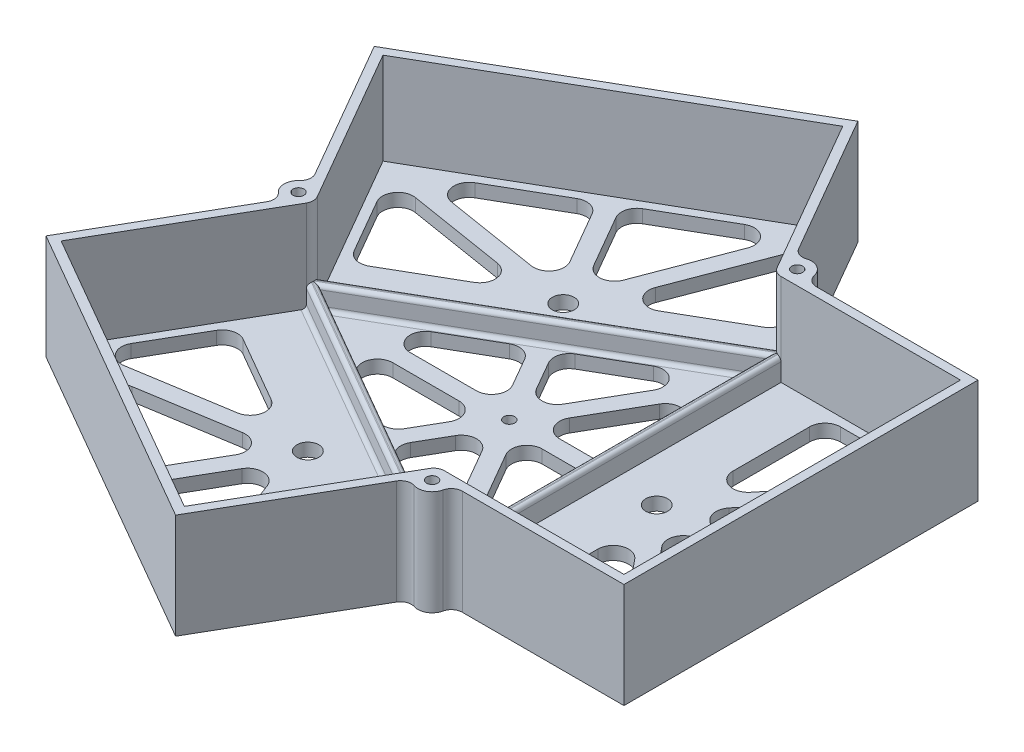
from build123d import *
from build123d.topology import SkipClean

# Parameters (mm, degrees)
SKETCH1_R           = 2.5000000000004525
SKETCH1_R_2         = 1.2499999999775333
SKETCH1_R_3         = 2.4999999999966116
SKETCH1_R_4         = 2.500000003454781
BOSS_EXTRUDE1_DEPTH = 3
BOSS_EXTRUDE2_DEPTH = 21
CUT_EXTRUDE1_DEPTH  = 135.64659558713754
FILLET1_R           = 2.5
BOSS_EXTRUDE3_START = 5
BOSS_EXTRUDE3_DEPTH = 5
FILLET2_R           = 0.9
FILLET3_R           = 3.5


with BuildPart() as part:
    # Sketch1 → Boss-Extrude1 (new body)
    with BuildSketch(Plane(origin=(0, 0, 0), x_dir=(1, 0, 0), z_dir=(0, 1, 0))):
        Polygon((56.65645136926783, -60.10357187391411), (89.54322408274156, -60.103571873914106), (89.54322408274156, 20.896428126098755), (56.65645136929464, 20.89642812609875), (40.952566782375555, 29.9630701196793), (24.509180425640395, 58.44385073802949), (-45.638877280922244, 17.943850738016113), (-29.195490924188032, -10.536929880332416), (-29.195490924188025, -28.6702138674958), (-45.63887728092128, -57.15099448584285), (24.50918042561817, -97.65099448584279), (40.95256678235395, -69.17021386749165), align=None)
        Polygon((2.098354485724329, -51.4676836533243), (-10.296899235219248, -72.93689287070575), (-36.64547418382551, -57.72453603136489), align=None, mode=Mode.SUBTRACT)
        Polygon((5.562456100861928, -53.46768365332455), (19.515777328519537, -90.14924971004358), (-6.832797620081495, -74.93689287070575), align=None, mode=Mode.SUBTRACT)
        Polygon((-26.67477566578673, -32.30420696853079), (0.06744719362658763, -47.74383653514203), (-39.25521457191352, -54.094166335458645), align=None, mode=Mode.SUBTRACT)
        with Locations(Location((5.9351515723503665, -48.82215616096494, 0), (0, 0, 270))):
            Circle(SKETCH1_R, mode=Mode.SUBTRACT)
        Polygon((19.34040746067872, -21.603571873920448), (10.778229596270998, -36.43369895851621), (-14.908303996952178, -21.603571873920448), align=None, mode=Mode.SUBTRACT)
        with Locations(Location((22.804509000002103, -19.60357200000875, 0), (0, 0, 270))):
            Circle(SKETCH1_R_2, mode=Mode.SUBTRACT)
        Polygon((9.802855951071862, -53.3645774019241), (36.54507881047721, -68.80420696853074), (23.964639904353078, -90.59416633545398), align=None, mode=Mode.SUBTRACT)
        Polygon((22.804509075842958, -23.603571873934307), (39.92886480465965, -53.26382604312798), (14.242331211434607, -38.433698958531146), align=None, mode=Mode.SUBTRACT)
        Polygon((26.26861069097249, -21.603571873920448), (43.392966196854054, -21.603571873920448), (43.39296619685239, -51.2638256569801), align=None, mode=Mode.SUBTRACT)
        Polygon((58.54322408275646, -56.10357187391411), (58.543224082756446, -25.22431274517261), (83.70410189401808, -56.10357187391412), align=None, mode=Mode.SUBTRACT)
        Polygon((85.54322408274153, -21.603571873907672), (85.54322408274153, -52.028285553285954), (60.752716637667696, -21.603571873907672), align=None, mode=Mode.SUBTRACT)
        Polygon((0.0674471936710681, 8.536692787309843), (-26.674775665774362, -6.902936779318866), (-39.25521457191333, 14.887022587629906), align=None, mode=Mode.SUBTRACT)
        Polygon((19.34040746069591, -17.603571873918206), (-14.908303560165617, -17.603571873918202), (10.778229705480529, -2.7734449784491244), align=None, mode=Mode.SUBTRACT)
        with Locations(Location((5.935151572357302, 9.615012413111248, 0), (0, 0, 270))):
            Circle(SKETCH1_R_3, mode=Mode.SUBTRACT)
        Polygon((2.098354485734852, 12.26053990550171), (-36.64547418382336, 18.517392283539962), (-10.296899235209807, 33.729749122885025), align=None, mode=Mode.SUBTRACT)
        Polygon((19.51577732854151, 50.9421059622301), (5.5624561008726, 14.26053990550171), (-6.832797620072052, 35.729749122885025), align=None, mode=Mode.SUBTRACT)
        Polygon((26.268610690958532, -17.603571873918206), (43.39296619685594, 12.056681909161409), (43.392966196854275, -17.603571873918206), align=None, mode=Mode.SUBTRACT)
        Polygon((22.804509075825827, -15.603571873904249), (14.24233132061928, -0.7734449784485484), (39.92886458624059, 14.056681917006195), align=None, mode=Mode.SUBTRACT)
        with Locations(Location((56.543224078743656, -19.603571872662247, 0), (0, 0, 270))):
            Circle(SKETCH1_R_4, mode=Mode.SUBTRACT)
        Polygon((60.7527166376677, -17.60357187390767), (85.54322408274153, 12.821141805470615), (85.54322408274153, -17.60357187390767), align=None, mode=Mode.SUBTRACT)
        Polygon((58.543224082756446, -13.982831003337512), (58.54322408275811, 16.89642812609875), (83.70410189455097, 16.896428126098755), align=None, mode=Mode.SUBTRACT)
        Polygon((36.5450788105132, 29.597063220693602), (9.802855951060122, 14.157433654059325), (23.964639904370056, 51.38702258764974), align=None, mode=Mode.SUBTRACT)
    extrude(amount=BOSS_EXTRUDE1_DEPTH)

    # Sketch2 → Boss-Extrude2 (add)
    with BuildSketch(Plane(origin=(0, 3, 0), x_dir=(1, 0, 0), z_dir=(0, 1, 0))):
        with BuildLine():
            Line((-24.173476287988574, -19.60357187391417), (-21.65146165178912, -19.6035718739142))
            Line((-21.65146165178912, -19.6035718739142), (-42.906826473353355, 17.21179993044725))
            Line((-42.906826473353355, 17.211799930447246), (23.777129618071534, 55.711799930460586))
            Line((23.777129618071534, 55.71179993046059), (45.032494439636004, 18.896428126098748))
            Line((45.032494439636004, 18.896428126098744), (46.293501757735555, 21.08055686976334))
            ThreePointArc((46.29350175773554, 21.08055686976335), (45.835970003005016, 22.788088624493902), (47.54350175773557, 23.245620379224423))
            Line((47.543501757735555, 23.245620379224427), (48.804509075835114, 25.429749122889028))
            Line((48.804509075835114, 25.42974912288902), (40.95256678237556, 29.9630701196793))
            Line((40.95256678237556, 29.9630701196793), (24.5091804256404, 58.44385073802949))
            Line((24.509180425640402, 58.4438507380295), (-45.63887728092225, 17.943850738016117))
            Line((-45.63887728092225, 17.943850738016117), (-29.195490924188032, -10.536929880332416))
            Line((-29.195490924188032, -10.536929880332416), (-29.19549092418803, -19.60357187391411))
            Line((-29.19549092418803, -19.60357187391411), (-26.673476287988574, -19.603571873914138))
            ThreePointArc((-26.673476287988574, -19.603571873914152), (-25.423476287988574, -18.353571873914152), (-24.173476287988574, -19.603571873914152))
        make_face()
        with BuildLine():
            Line((-42.90682647335239, -56.41894367827395), (-21.651461651789116, -19.6035718739142))
            Line((-21.65146165178912, -19.6035718739142), (-24.173476287988574, -19.60357187391417))
            ThreePointArc((-24.173476287988574, -19.603571873914152), (-25.423476287988574, -20.853571873914152), (-26.673476287988574, -19.603571873914152))
            Line((-26.673476287988574, -19.603571873914138), (-29.19549092418803, -19.60357187391411))
            Line((-29.19549092418803, -19.60357187391411), (-29.195490924188025, -28.670213867495804))
            Line((-29.195490924188025, -28.670213867495804), (-45.63887728092128, -57.15099448584286))
            Line((-45.63887728092128, -57.15099448584286), (24.509180425618187, -97.65099448584279))
            Line((24.509180425618187, -97.65099448584279), (40.95256678235394, -69.17021386749165))
            Line((40.95256678235394, -69.17021386749165), (48.804509075810884, -64.63689287070288))
            Line((48.804509075810884, -64.63689287070288), (47.543501757711766, -62.45276412703905))
            ThreePointArc((47.54350175771178, -62.452764127039046), (45.83597000298122, -61.99523237230852), (46.293501757711745, -60.28770061757796))
            Line((46.29350175771176, -60.287700617577954), (45.03249443961264, -58.10357187391411))
            Line((45.03249443961264, -58.10357187391411), (23.777129618049344, -94.91894367827395))
            Line((23.777129618049344, -94.91894367827395), (-42.906826473352396, -56.41894367827395))
        make_face()
        with BuildLine():
            Line((46.293501757735555, 21.08055686976334), (45.032494439636004, 18.896428126098744))
            Line((45.032494439636004, 18.896428126098744), (87.54322408274155, 18.896428126098748))
            Line((87.54322408274155, 18.896428126098748), (87.54322408274155, -58.1035718739141))
            Line((87.54322408274155, -58.103571873914106), (45.03249443961264, -58.10357187391411))
            Line((45.03249443961264, -58.10357187391411), (46.29350175771176, -60.287700617577954))
            ThreePointArc((46.293501757711745, -60.28770061757796), (47.54350175771176, -60.28770061757794), (48.16850175771177, -61.3702323723085))
            ThreePointArc((48.16850175771177, -61.3702323723085), (48.00103351244232, -61.99523237230849), (47.54350175771178, -62.452764127039046))
            Line((47.543501757711766, -62.45276412703905), (48.804509075810884, -64.63689287070288))
            Line((48.804509075810884, -64.63689287070288), (56.65645136926783, -60.10357187391411))
            Line((56.65645136926783, -60.10357187391411), (89.54322408274156, -60.103571873914106))
            Line((89.54322408274156, -60.103571873914106), (89.54322408274156, 20.896428126098755))
            Line((89.54322408274156, 20.896428126098755), (56.65645136929464, 20.89642812609875))
            Line((56.65645136929464, 20.89642812609875), (48.804509075835114, 25.42974912288902))
            Line((48.804509075835114, 25.429749122889028), (47.543501757735555, 23.245620379224427))
            ThreePointArc((47.54350175773557, 23.245620379224423), (48.00103351246611, 22.788088624493877), (48.168501757735555, 22.163088624493888))
            ThreePointArc((48.168501757735555, 22.163088624493888), (47.54350175773555, 21.08055686976334), (46.29350175773554, 21.08055686976335))
        make_face()
    extrude(amount=BOSS_EXTRUDE2_DEPTH)

    # Sketch4 → Cut-Extrude1 (cut, through all)
    with SkipClean():  # the faces are left unmerged after this step: merging them gives an invalid solid
        with BuildSketch(Plane(origin=(0, 24, 0), x_dir=(1, 0, 0), z_dir=(0, 1, 0))):
            with BuildLine():
                Line((-29.195490924188032, -10.536929880332416), (-25.832059375307356, -16.36256421077386))
                ThreePointArc((-25.832059375307356, -16.36256421077386), (-28.690136786384, -19.603571873914127), (-25.832059375307402, -22.84457953705444))
                Line((-25.832059375307402, -22.84457953705444), (-29.195490924188025, -28.670213867495804))
                Line((-29.195490924188025, -28.670213867495804), (-29.195490924188032, -10.536929880332416))
            make_face()
            with BuildLine():
                Line((40.95256677782538, 29.963069864886865), (56.65645136474641, 20.8964278713051))
                Line((56.65645136474641, 20.8964278713051), (49.929588266985036, 20.89642787130515))
                ThreePointArc((49.929588266985036, 20.89642787130515), (48.55183200238386, 24.99209934685012), (44.31599832670601, 24.1374355344455))
                Line((44.31599832670601, 24.1374355344455), (40.95256677782538, 29.963069864886865))
            make_face()
            with BuildLine():
                Line((56.65645114636252, -60.10357199738482), (40.95256655944137, -69.17021399096637))
                Line((40.95256655944137, -69.17021399096637), (44.31599810832213, -63.34457966052498))
                ThreePointArc((44.31599810832213, -63.34457966052498), (48.551831783999944, -64.19924347292971), (49.92958804860124, -60.10357199738478))
                Line((49.92958804860124, -60.10357199738478), (56.65645114636252, -60.10357199738482))
            make_face()
        extrude(amount=-CUT_EXTRUDE1_DEPTH, mode=Mode.SUBTRACT)

    # Fillet1
    fillet1_edges = [part.edges().sort_by_distance(p)[0] for p in [
        (45.03249443961264, 13.5, 58.10357187391411),
        (-21.65146165178912, 13.5, 19.6035718739142),
        (45.032494439636004, 13.5, -18.896428126098748),
        (-25.832059375307356, 12, 16.36256421077386),
        (-25.832059375307402, 12, 22.84457953705444),
        (49.929588266985036, 12, -20.89642787130515),
        (44.31599832670601, 12, -24.1374355344455),
        (44.31599810832213, 12, 63.34457966052498),
        (49.92958804860124, 12, 60.10357199738478),
    ]]
    fillet(fillet1_edges, radius=FILLET1_R)

    # Sketch5 → Boss-Extrude3 (add)
    with SkipClean():  # the faces are left unmerged after this step: merging them gives an invalid solid
        with BuildSketch(Plane(origin=(0, 3, 0), x_dir=(1, 0, 0), z_dir=(0, 1, 0)).offset(BOSS_EXTRUDE3_START)):
            with BuildLine():
                Line((-22.37314948827615, -20.853571873914206), (44.310806603125606, -59.35357187391412))
                ThreePointArc((44.310806603125606, -59.35357187391412), (45.225870112586705, -58.43850836445302), (46.475870112586705, -58.10357187391411))
                Line((46.475870112586705, -58.10357187391411), (46.47587011261007, 18.896428126098744))
                ThreePointArc((46.47587011261007, 18.896428126098744), (45.22587011261007, 19.231364616637638), (44.31080660314897, 20.146428126098733))
                Line((44.31080660314897, 20.146428126098733), (-22.373149488276148, -18.35357187391421))
                ThreePointArc((-22.373149488276148, -18.35357187391421), (-22.038212997737247, -19.60357187391421), (-22.37314948827615, -20.853571873914206))
            make_face()
            Polygon((44.47587011261007, 17.932326510960987), (-20.538212997737247, -19.60357187391421), (44.47587011261007, -57.139470258789856), align=None, mode=Mode.SUBTRACT)
        extrude(amount=-BOSS_EXTRUDE3_DEPTH)

    # Fillet2
    # the kernel refuses this fillet: 0.9 mm, written as the material it adds along each edge
    with BuildSketch(Plane(origin=(44.47587011261007, 3, 59.389470258789856), x_dir=(-1, 0, 0), z_dir=(0, 0, -1))) as fillet2_piece_1_section:
        with BuildLine():
            CenterArc((FILLET2_R, FILLET2_R), FILLET2_R, 179.99999999999997, 90)
            Line((0, FILLET2_R), (0, 0))
            Line((0, 0), (FILLET2_R, 0))
        make_face()
    fillet2_piece_1 = extrude(amount=79.57179676975085, mode=Mode.PRIVATE)
    fillet2_piece_1 = split(fillet2_piece_1, bisect_by=Plane(origin=(10.994549978179414, 3, 1.3981226814763232), z_dir=(0.4999999999999948, 0, 0.8660254037844417)), keep=Keep.TOP, mode=Mode.PRIVATE)
    add(fillet2_piece_1)
    with BuildSketch(Plane(origin=(46.42442727112506, 3, -19.057326510960976), x_dir=(0.49999999999999484, 0, 0.8660254037844417), z_dir=(-0.8660254037844417, 0, 0.4999999999999948))) as fillet2_piece_2_section:
        with BuildLine():
            CenterArc((FILLET2_R, FILLET2_R), FILLET2_R, 179.99999999999997, 90)
            Line((-4.8e-16, FILLET2_R), (0, 0))
            Line((0, 0), (FILLET2_R, 0))
        make_face()
    fillet2_piece_2 = extrude(amount=79.5717967697512, mode=Mode.PRIVATE)
    fillet2_piece_2 = split(fillet2_piece_2, bisect_by=Plane(origin=(44.47587011261007, 3, -19.057326510960976), z_dir=(-1, 0, 0)), keep=Keep.TOP, mode=Mode.PRIVATE)
    add(fillet2_piece_2)
    with BuildSketch(Plane(origin=(-22.37314948827615, 3, 20.853571873914206), x_dir=(-0.49999999999999933, 0, 0.866025403784439), z_dir=(0.866025403784439, 0, 0.4999999999999993))) as fillet2_piece_3:
        with BuildLine():
            CenterArc((FILLET2_R, -FILLET2_R), FILLET2_R, 90, 90)
            Line((1.78e-15, -FILLET2_R), (0, 0))
            Line((0, 0), (FILLET2_R, 0))
        make_face()
    extrude(amount=76.99999999999994)
    # the kernel refuses this fillet: 0.9 mm, written as the material it takes off along each edge
    with BuildSketch(Plane(origin=(-24.321706646791146, 8, 19.728571873914206), x_dir=(0.49999999999999933, 0, -0.866025403784439), z_dir=(0.866025403784439, 0, 0.4999999999999993))) as fillet2_2_piece_1_section:
        with BuildLine():
            CenterArc((FILLET2_R, -FILLET2_R), FILLET2_R, 90, 90)
            Line((1.78e-15, -FILLET2_R), (0, 0))
            Line((0, 0), (FILLET2_R, 0))
        make_face()
    fillet2_2_piece_1 = extrude(amount=81.49999999999993, mode=Mode.PRIVATE)
    fillet2_2_piece_1 = fillet2_2_piece_1 - Plane(origin=(-24.53821299773724, 8, 19.6035718739142), x_dir=(0.8660254037844387, 0, -0.4999999999999999), z_dir=(0, 1, 0)) * Cylinder(2.5, 167, mode=Mode.PRIVATE)
    fillet2_2_piece_1 = fillet2_2_piece_1 - Plane(origin=(46.475870112586705, 8, 60.60357187391411), x_dir=(-0.8660254037844388, 0, -0.49999999999999983), z_dir=(0, 1, 0)) * Cylinder(2.5, 167, mode=Mode.PRIVATE)
    add(fillet2_2_piece_1, mode=Mode.SUBTRACT)
    with BuildSketch(Plane(origin=(46.47587011258602, 8, 60.35357187391411), x_dir=(-1, 0, -3.0341e-13), z_dir=(3.0341e-13, 0, -1))) as fillet2_2_piece_2_section:
        with BuildLine():
            CenterArc((FILLET2_R, -FILLET2_R), FILLET2_R, 90, 90)
            Line((0, -FILLET2_R), (0, 0))
            Line((0, 0), (FILLET2_R, 0))
        make_face()
    fillet2_2_piece_2 = extrude(amount=81.50000000001286, mode=Mode.PRIVATE)
    fillet2_2_piece_2 = fillet2_2_piece_2 - Plane(origin=(46.475870112586705, 8, 60.60357187391411), x_dir=(-0.8660254037844388, 0, -0.49999999999999983), z_dir=(0, 1, 0)) * Cylinder(2.5, 167, mode=Mode.PRIVATE)
    fillet2_2_piece_2 = fillet2_2_piece_2 - Plane(origin=(46.475870112610075, 8, -21.39642812609874), x_dir=(-0.8660254037844387, 0, 0.5000000000000001), z_dir=(0, 1, 0)) * Cylinder(2.5, 167, mode=Mode.PRIVATE)
    add(fillet2_2_piece_2, mode=Mode.SUBTRACT)
    with BuildSketch(Plane(origin=(46.25936376166396, 8, -21.271428126098723), x_dir=(0.49999999999999484, 0, 0.8660254037844416), z_dir=(-0.8660254037844416, 0, 0.49999999999999484))) as fillet2_2_piece_3_section:
        with BuildLine():
            CenterArc((FILLET2_R, -FILLET2_R), FILLET2_R, 90, 90)
            Line((0, -FILLET2_R), (0, 0))
            Line((0, 0), (FILLET2_R, 0))
        make_face()
    fillet2_2_piece_3 = extrude(amount=81.50000000002669, mode=Mode.PRIVATE)
    fillet2_2_piece_3 = fillet2_2_piece_3 - Plane(origin=(-24.53821299773724, 8, 19.6035718739142), x_dir=(0.8660254037844387, 0, -0.4999999999999999), z_dir=(0, 1, 0)) * Cylinder(2.5, 167, mode=Mode.PRIVATE)
    fillet2_2_piece_3 = fillet2_2_piece_3 - Plane(origin=(46.475870112610075, 8, -21.39642812609874), x_dir=(-0.8660254037844387, 0, 0.5000000000000001), z_dir=(0, 1, 0)) * Cylinder(2.5, 167, mode=Mode.PRIVATE)
    add(fillet2_2_piece_3, mode=Mode.SUBTRACT)
    with BuildSketch(Plane(origin=(44.47587011261007, 8, 59.389470258789856), x_dir=(1, 0, 0), z_dir=(0, 0, -1))) as fillet2_2_piece_4_section:
        with BuildLine():
            CenterArc((FILLET2_R, FILLET2_R), FILLET2_R, 180, 90)
            Line((0, FILLET2_R), (0, 0))
            Line((0, 0), (FILLET2_R, 0))
        make_face()
    fillet2_2_piece_4 = extrude(amount=79.57179676975085, mode=Mode.PRIVATE)
    fillet2_2_piece_4 = split(fillet2_2_piece_4, bisect_by=Plane(origin=(10.994549978179407, 8, 1.398122681476309), z_dir=(0.4999999999999948, 0, 0.8660254037844417)), keep=Keep.TOP, mode=Mode.PRIVATE)
    fillet2_2_piece_4 = split(fillet2_2_piece_4, bisect_by=Plane(origin=(45.450148691867554, 8, 57.701970258789856), z_dir=(0.4999999999999993, 0, -0.8660254037844392)), keep=Keep.TOP, mode=Mode.PRIVATE)
    add(fillet2_2_piece_4, mode=Mode.SUBTRACT)
    with BuildSketch(Plane(origin=(46.42442727112506, 8, -19.057326510960976), x_dir=(-0.49999999999999484, 0, -0.8660254037844417), z_dir=(-0.8660254037844417, 0, 0.4999999999999948))) as fillet2_2_piece_5_section:
        with BuildLine():
            CenterArc((FILLET2_R, FILLET2_R), FILLET2_R, 180, 90)
            Line((4.8e-16, FILLET2_R), (0, 0))
            Line((0, 0), (FILLET2_R, 0))
        make_face()
    fillet2_2_piece_5 = extrude(amount=79.5717967697512, mode=Mode.PRIVATE)
    fillet2_2_piece_5 = split(fillet2_2_piece_5, bisect_by=Plane(origin=(12.943107136694202, 8, 38.93402106635222), z_dir=(0.4999999999999993, 0, -0.8660254037844392)), keep=Keep.TOP, mode=Mode.PRIVATE)
    fillet2_2_piece_5 = split(fillet2_2_piece_5, bisect_by=Plane(origin=(44.47587011261007, 8, -19.057326510960976), z_dir=(-1, 0, 0)), keep=Keep.TOP, mode=Mode.PRIVATE)
    add(fillet2_2_piece_5, mode=Mode.SUBTRACT)
    with BuildSketch(Plane(origin=(-22.48677015625224, 8, 18.47857187391421), x_dir=(-0.49999999999999933, 0, 0.8660254037844392), z_dir=(0.8660254037844392, 0, 0.4999999999999993))) as fillet2_2_piece_6_section:
        with BuildLine():
            CenterArc((FILLET2_R, FILLET2_R), FILLET2_R, 180, 90)
            Line((4.38e-15, FILLET2_R), (0, 0))
            Line((0, 0), (FILLET2_R, 0))
        make_face()
    fillet2_2_piece_6 = extrude(amount=79.57179676975142, mode=Mode.PRIVATE)
    fillet2_2_piece_6 = split(fillet2_2_piece_6, bisect_by=Plane(origin=(-21.51249157699476, 8, 20.166071873914216), z_dir=(0.4999999999999948, 0, 0.8660254037844417)), keep=Keep.TOP, mode=Mode.PRIVATE)
    fillet2_2_piece_6 = split(fillet2_2_piece_6, bisect_by=Plane(origin=(44.475870112610075, 8, 18.47857187391421), z_dir=(-1, 0, 0)), keep=Keep.TOP, mode=Mode.PRIVATE)
    add(fillet2_2_piece_6, mode=Mode.SUBTRACT)
    with BuildSketch(Plane(origin=(44.47587011261007, 8, 59.389470258789856), x_dir=(1, 0, 0), z_dir=(0, 0, -1))) as fillet2_2_piece_7a_section:
        with BuildLine():
            CenterArc((FILLET2_R, FILLET2_R), FILLET2_R, 180, 90)
            Line((0, FILLET2_R), (0, 0))
            Line((0, 0), (FILLET2_R, 0))
        make_face()
    fillet2_2_piece_7a = extrude(amount=79.57179676975085, mode=Mode.PRIVATE)
    fillet2_2_piece_7a = split(fillet2_2_piece_7a, bisect_by=Plane(origin=(45.45014869186756, 8, 57.70197025878985), z_dir=(-0.4999999999999993, 0, 0.8660254037844392)), keep=Keep.TOP, mode=Mode.PRIVATE)
    fillet2_2_piece_7a = fillet2_2_piece_7a - Plane(origin=(46.475870112586705, 8, 60.60357187391411), x_dir=(-0.8660254037844388, 0, -0.49999999999999983), z_dir=(0, 1, 0)) * Cylinder(2.5, 163, mode=Mode.PRIVATE)
    with BuildSketch(Plane(origin=(-22.48677015625224, 8, 18.47857187391421), x_dir=(-0.49999999999999933, 0, 0.8660254037844392), z_dir=(0.8660254037844392, 0, 0.4999999999999993))) as fillet2_2_piece_7b_section:
        with BuildLine():
            CenterArc((FILLET2_R, FILLET2_R), FILLET2_R, 180, 90)
            Line((4.38e-15, FILLET2_R), (0, 0))
            Line((0, 0), (FILLET2_R, 0))
        make_face()
    fillet2_2_piece_7b = extrude(amount=79.57179676975142, mode=Mode.PRIVATE)
    fillet2_2_piece_7b = split(fillet2_2_piece_7b, bisect_by=Plane(origin=(44.475870112610075, 8, 18.47857187391421), z_dir=(1, 0, 0)), keep=Keep.TOP, mode=Mode.PRIVATE)
    fillet2_2_piece_7b = fillet2_2_piece_7b - Plane(origin=(46.475870112586705, 8, 60.60357187391411), x_dir=(-0.8660254037844388, 0, -0.49999999999999983), z_dir=(0, 1, 0)) * Cylinder(2.5, 163, mode=Mode.PRIVATE)
    fillet2_2_piece_7 = fillet2_2_piece_7a & fillet2_2_piece_7b
    add(fillet2_2_piece_7, mode=Mode.SUBTRACT)
    with BuildSketch(Plane(origin=(44.47587011261007, 8, 59.389470258789856), x_dir=(1, 0, 0), z_dir=(0, 0, -1))) as fillet2_2_piece_8a_section:
        with BuildLine():
            CenterArc((FILLET2_R, FILLET2_R), FILLET2_R, 180, 90)
            Line((0, FILLET2_R), (0, 0))
            Line((0, 0), (FILLET2_R, 0))
        make_face()
    fillet2_2_piece_8a = extrude(amount=79.57179676975085, mode=Mode.PRIVATE)
    fillet2_2_piece_8a = split(fillet2_2_piece_8a, bisect_by=Plane(origin=(10.994549978179414, 8, 1.3981226814763232), z_dir=(-0.4999999999999948, 0, -0.8660254037844417)), keep=Keep.TOP, mode=Mode.PRIVATE)
    fillet2_2_piece_8a = fillet2_2_piece_8a - Plane(origin=(46.475870112610075, 8, -21.39642812609874), x_dir=(-0.8660254037844387, 0, 0.5000000000000001), z_dir=(0, 1, 0)) * Cylinder(2.5, 163, mode=Mode.PRIVATE)
    with BuildSketch(Plane(origin=(46.42442727112506, 8, -19.057326510960976), x_dir=(-0.49999999999999484, 0, -0.8660254037844417), z_dir=(-0.8660254037844417, 0, 0.4999999999999948))) as fillet2_2_piece_8b_section:
        with BuildLine():
            CenterArc((FILLET2_R, FILLET2_R), FILLET2_R, 180, 90)
            Line((4.8e-16, FILLET2_R), (0, 0))
            Line((0, 0), (FILLET2_R, 0))
        make_face()
    fillet2_2_piece_8b = extrude(amount=79.5717967697512, mode=Mode.PRIVATE)
    fillet2_2_piece_8b = split(fillet2_2_piece_8b, bisect_by=Plane(origin=(44.47587011261007, 8, -19.057326510960976), z_dir=(1, 0, 0)), keep=Keep.TOP, mode=Mode.PRIVATE)
    fillet2_2_piece_8b = fillet2_2_piece_8b - Plane(origin=(46.475870112610075, 8, -21.39642812609874), x_dir=(-0.8660254037844387, 0, 0.5000000000000001), z_dir=(0, 1, 0)) * Cylinder(2.5, 163, mode=Mode.PRIVATE)
    fillet2_2_piece_8 = fillet2_2_piece_8a & fillet2_2_piece_8b
    add(fillet2_2_piece_8, mode=Mode.SUBTRACT)
    with BuildSketch(Plane(origin=(-22.48677015625224, 8, 18.47857187391421), x_dir=(-0.49999999999999933, 0, 0.8660254037844392), z_dir=(0.8660254037844392, 0, 0.4999999999999993))) as fillet2_2_piece_9a_section:
        with BuildLine():
            CenterArc((FILLET2_R, FILLET2_R), FILLET2_R, 180, 90)
            Line((4.38e-15, FILLET2_R), (0, 0))
            Line((0, 0), (FILLET2_R, 0))
        make_face()
    fillet2_2_piece_9a = extrude(amount=79.57179676975142, mode=Mode.PRIVATE)
    fillet2_2_piece_9a = fillet2_2_piece_9a - Plane(origin=(-24.53821299773724, 8, 19.6035718739142), x_dir=(0.8660254037844387, 0, -0.4999999999999999), z_dir=(0, 1, 0)) * Cylinder(2.5, 163, mode=Mode.PRIVATE)
    fillet2_2_piece_9a = split(fillet2_2_piece_9a, bisect_by=Plane(origin=(-21.51249157699476, 8, 20.166071873914213), z_dir=(-0.4999999999999948, 0, -0.8660254037844417)), keep=Keep.TOP, mode=Mode.PRIVATE)
    with BuildSketch(Plane(origin=(46.42442727112506, 8, -19.057326510960976), x_dir=(-0.49999999999999484, 0, -0.8660254037844417), z_dir=(-0.8660254037844417, 0, 0.4999999999999948))) as fillet2_2_piece_9b_section:
        with BuildLine():
            CenterArc((FILLET2_R, FILLET2_R), FILLET2_R, 180, 90)
            Line((4.8e-16, FILLET2_R), (0, 0))
            Line((0, 0), (FILLET2_R, 0))
        make_face()
    fillet2_2_piece_9b = extrude(amount=79.5717967697512, mode=Mode.PRIVATE)
    fillet2_2_piece_9b = fillet2_2_piece_9b - Plane(origin=(-24.53821299773724, 8, 19.6035718739142), x_dir=(0.8660254037844387, 0, -0.4999999999999999), z_dir=(0, 1, 0)) * Cylinder(2.5, 163, mode=Mode.PRIVATE)
    fillet2_2_piece_9b = split(fillet2_2_piece_9b, bisect_by=Plane(origin=(12.94310713669421, 8, 38.934021066352216), z_dir=(-0.4999999999999993, 0, 0.8660254037844392)), keep=Keep.TOP, mode=Mode.PRIVATE)
    fillet2_2_piece_9 = fillet2_2_piece_9a & fillet2_2_piece_9b
    add(fillet2_2_piece_9, mode=Mode.SUBTRACT)

    # Fillet3
    fillet3_edges = [part.edges().sort_by_distance(p)[0] for p in [
        (19.51577732851954, 1.5, 90.14924971004358),
        (5.562456100861928, 1.5, 53.46768365332455),
        (-6.832797620081495, 1.5, 74.93689287070575),
        (19.51577732854151, 1.5, -50.9421059622301),
        (-6.832797620072052, 1.5, -35.729749122885025),
        (5.5624561008726, 1.5, -14.26053990550171),
        (85.54322408274153, 1.5, -12.821141805470617),
        (60.7527166376677, 1.5, 17.60357187390767),
        (85.54322408274153, 1.5, 17.60357187390767),
        (58.54322408275646, 1.5, 56.10357187391411),
        (83.70410189401808, 1.5, 56.10357187391412),
        (58.543224082756446, 1.5, 25.22431274517261),
        (-26.674775665774362, 1.5, 6.902936779318866),
        (0.06744719367106988, 1.5, -8.536692787309843),
        (-39.25521457191333, 1.5, -14.887022587629906),
        (36.5450788105132, 1.5, -29.597063220693602),
        (23.964639904370056, 1.5, -51.38702258764974),
        (9.802855951060122, 1.5, -14.157433654059325),
        (58.54322408275811, 1.5, -16.89642812609875),
        (58.54322408275645, 1.5, 13.982831003337514),
        (83.70410189455097, 1.5, -16.896428126098755),
        (36.54507881047721, 1.5, 68.80420696853074),
        (9.802855951071862, 1.5, 53.3645774019241),
        (23.964639904353078, 1.5, 90.59416633545398),
        (-26.67477566578673, 1.5, 32.30420696853079),
        (-39.25521457191352, 1.5, 54.094166335458645),
        (0.06744719362658763, 1.5, 47.74383653514203),
        (60.752716637667696, 1.5, 21.603571873907672),
        (85.54322408274153, 1.5, 52.028285553285954),
        (85.54322408274153, 1.5, 21.603571873907672),
        (-10.296899235209807, 1.5, -33.729749122885025),
        (-36.64547418382336, 1.5, -18.517392283539962),
        (2.0983544857348506, 1.5, -12.26053990550171),
        (2.0983544857243284, 1.5, 51.4676836533243),
        (-36.64547418382551, 1.5, 57.72453603136489),
        (-10.296899235219248, 1.5, 72.93689287070575),
        (22.804509075842958, 1.5, 23.603571873934307),
        (14.24233121143461, 1.5, 38.43369895853115),
        (39.92886480465965, 1.5, 53.263826043127985),
        (19.34040746069591, 1.5, 17.603571873918206),
        (10.77822970548053, 1.5, 2.773444978449124),
        (-14.908303560165617, 1.5, 17.603571873918206),
        (43.392966196854054, 1.5, 21.603571873920448),
        (26.26861069097249, 1.5, 21.603571873920444),
        (43.39296619685239, 1.5, 51.2638256569801),
        (10.778229596270993, 1.5, 36.43369895851621),
        (19.34040746067872, 1.5, 21.603571873920448),
        (-14.908303996952178, 1.5, 21.603571873920448),
        (14.242331320619282, 1.5, 0.7734449784485493),
        (22.804509075825827, 1.5, 15.60357187390425),
        (39.92886458624059, 1.5, -14.056681917006195),
        (26.268610690958532, 1.5, 17.603571873918206),
        (43.392966196854275, 1.5, 17.603571873918206),
        (43.39296619685594, 1.5, -12.05668190916141),
    ]]
    fillet(fillet3_edges, radius=FILLET3_R)


solid = part.part
